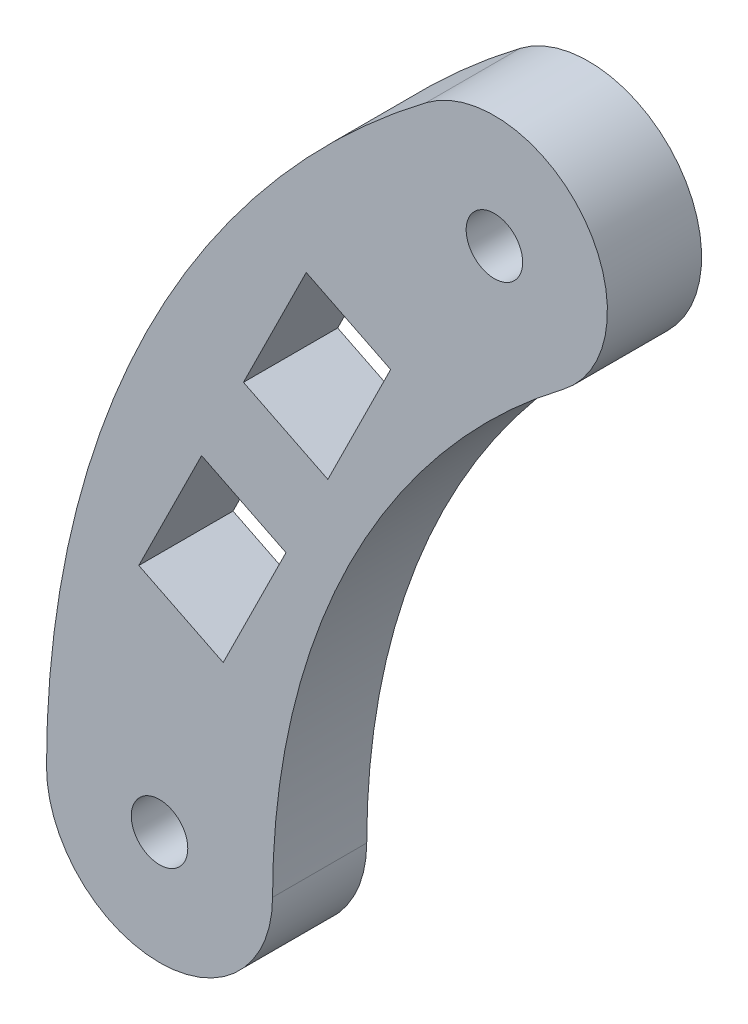
from build123d import *

# Parameters (mm, degrees)
ESQUISSE1_R        = 1.5
BOSS_EXTRU_1_DEPTH = 5


with BuildPart() as part:
    # Esquisse1 → Boss.-Extru.1 (new body)
    with BuildSketch(Plane.XY):
        with BuildLine():
            ThreePointArc((-30.851851852, 40.60989088), (-45.68612724, 22.666666667), (-51, 0))
            ThreePointArc((-51, 0), (-45, -6), (-39, 0))
            ThreePointArc((-39, 0), (-34.936450243, 17.333333333), (-23.592592593, 31.054622438))
            ThreePointArc((-23.592592593, 31.054622438), (-22.444588001, 39.461886289), (-30.851851852, 40.60989088))
        make_face()
        with Locations((-27.222222222, 35.832256659)):
            Circle(ESQUISSE1_R, mode=Mode.SUBTRACT)
        with Locations((-45, 0)):
            Circle(ESQUISSE1_R, mode=Mode.SUBTRACT)
        Polygon((-32.731521839, 27.402508609), (-36.064855173, 20.683960486), (-40.543887255, 22.906182708), (-37.210553922, 29.624730831), align=None, mode=Mode.SUBTRACT)
        Polygon((-46.099442811, 11.708602502), (-41.620410728, 9.48638028), (-38.287077395, 16.204928403), (-42.766109477, 18.427150625), align=None, mode=Mode.SUBTRACT)
    extrude(amount=BOSS_EXTRU_1_DEPTH)


solid = part.part
